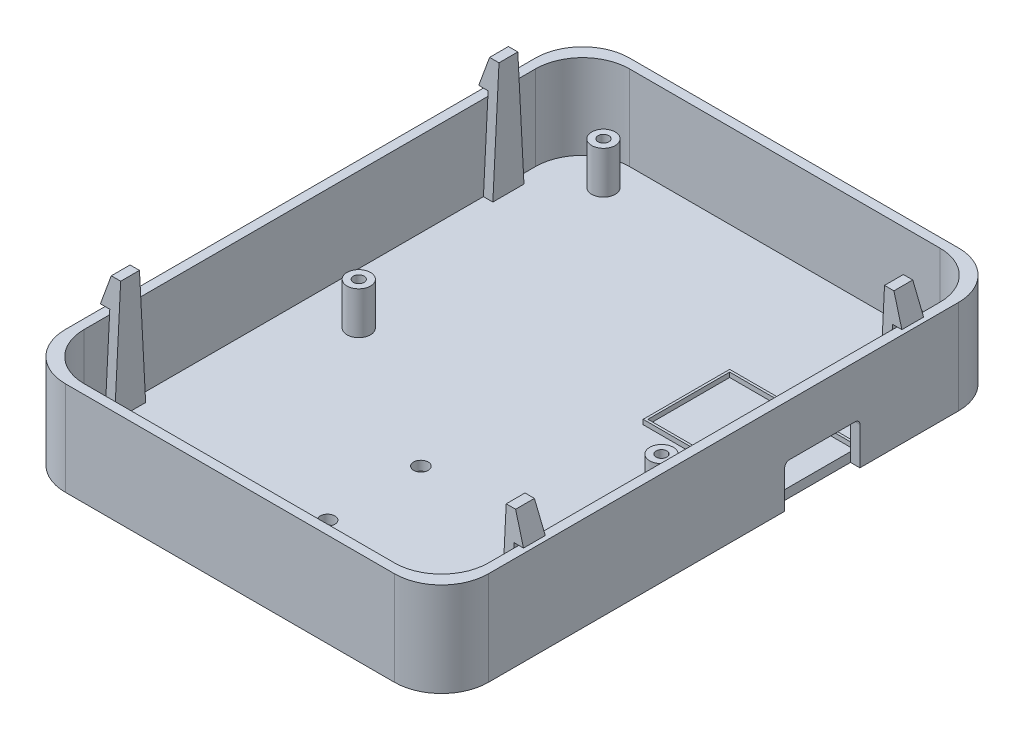
from build123d import *

# Parameters (mm, degrees)
CROQUIS2_W                   = 90
CROQUIS2_H                   = 120
SALIENTE_EXTRUIR1_DEPTH      = 20
VACIADO1_T                   = -2
REDONDEO1_R                  = 10
CROQUIS3_R                   = 1.55
CORTAR_EXTRUIR1_DEPTH        = 20
CROQUIS4_R                   = 2.5
CROQUIS4_R_2                 = 1.15
SALIENTE_EXTRUIR2_DEPTH      = 9
CROQUIS5_W                   = 16
CROQUIS5_H                   = 9
CORTAR_EXTRUIR2_DEPTH        = 2
REDONDEO2_R                  = 1
SALIENTE_EXTRUIR3_DEPTH      = 1
GANCHO_START                 = 41
GANCHO_DE_MOSQUET_N1_DEPTH   = 2
GANCHO_START_2               = -42.549292451
GANCHO_DE_MOSQUET_N1_2_DEPTH = 4.628893351
GANCHO_START_3               = 43
GANCHO_DE_MOSQUET_N1_3_DEPTH = 3
GANCHO_DE_MOSQUET_N1_4_DEPTH = 2
SIMETR_A2_START              = 41
SIMETR_A2_COPY_1_DEPTH       = 2
SIMETR_A2_START_2            = -42.549292451
SIMETR_A2_COPY_2_DEPTH       = 4.628893351
SIMETR_A2_START_3            = 43
SIMETR_A2_COPY_3_DEPTH       = 3
SIMETR_A2_COPY_4_DEPTH       = 2


with BuildPart() as part:
    # Croquis2 → Saliente-Extruir1 (new body)
    with BuildSketch(Plane(origin=(0, 0, 0), x_dir=(1, 0, 0), z_dir=(0, 1, 0))):
        Rectangle(CROQUIS2_W, CROQUIS2_H)
    extrude(amount=SALIENTE_EXTRUIR1_DEPTH)

    # Vaciado1
    vaciado1_openings = [part.faces().sort_by_distance(p)[0] for p in [
        (0, 20, 0),
    ]]
    offset(amount=VACIADO1_T, openings=vaciado1_openings, kind=Kind.INTERSECTION)

    # Redondeo1
    redondeo1_edges = [part.edges().sort_by_distance(p)[0] for p in [
        (-43, 11, -58),
        (-43, 11, 58),
        (43, 11, 58),
        (43, 11, -58),
        (-45, 10, -60),
        (45, 10, -60),
        (45, 10, 60),
        (-45, 10, 60),
    ]]
    fillet(redondeo1_edges, radius=REDONDEO1_R)

    # Croquis3 → Cortar-Extruir1 (cut)
    with BuildSketch(Plane(origin=(0, 2, 0), x_dir=(1, 0, 0), z_dir=(0, 1, 0))):
        with Locations(Location((0, -39.225, 0), (0, 0, 270))):
            Circle(CROQUIS3_R)
        with Locations(Location((0, -19.375, 0), (0, 0, 270))):
            Circle(CROQUIS3_R)
    extrude(amount=-CORTAR_EXTRUIR1_DEPTH, mode=Mode.SUBTRACT)

    # Croquis4 → Saliente-Extruir2 (add)
    # profile 1 of 4: a face of its own
    with BuildSketch(Plane(origin=(0, 2, 0), x_dir=(1, 0, 0), z_dir=(0, 1, 0))):
        with Locations(Location((-31.9, 51.355578, 0), (0, 0, 90))):
            Circle(CROQUIS4_R)
        with Locations(Location((-31.9, 51.355578, 0), (0, 0, 270))):
            Circle(CROQUIS4_R_2, mode=Mode.SUBTRACT)
    # profile 2 of 4: a face of its own
    with BuildSketch(Plane(origin=(0, 2, 0), x_dir=(1, 0, 0), z_dir=(0, 1, 0))):
        with Locations(Location((32.5, 51.355578, 0), (0, 0, 90))):
            Circle(CROQUIS4_R)
        with Locations(Location((32.5, 51.355578, 0), (0, 0, 270))):
            Circle(CROQUIS4_R_2, mode=Mode.SUBTRACT)
    # profile 3 of 4: a face of its own
    with BuildSketch(Plane(origin=(0, 2, 0), x_dir=(1, 0, 0), z_dir=(0, 1, 0))):
        with Locations(Location((32.35, -0.544422, 0), (0, 0, 90))):
            Circle(CROQUIS4_R)
        with Locations(Location((32.35, -0.544422, 0), (0, 0, 270))):
            Circle(CROQUIS4_R_2, mode=Mode.SUBTRACT)
    # profile 4 of 4: a face of its own
    with BuildSketch(Plane(origin=(0, 2, 0), x_dir=(1, 0, 0), z_dir=(0, 1, 0))):
        with Locations(Location((-32.05, -0.544422, 0), (0, 0, 90))):
            Circle(CROQUIS4_R)
        with Locations(Location((-32.05, -0.544422, 0), (0, 0, 270))):
            Circle(CROQUIS4_R_2, mode=Mode.SUBTRACT)
    extrude(amount=SALIENTE_EXTRUIR2_DEPTH)

    # Croquis5 → Cortar-Extruir2 (cut)
    with BuildSketch(Plane(origin=(45, 0, 0), x_dir=(0, 0, -1), z_dir=(1, 0, 0))):
        with Locations((21, 4.5)):
            Rectangle(CROQUIS5_W, CROQUIS5_H)
    extrude(amount=-CORTAR_EXTRUIR2_DEPTH, mode=Mode.SUBTRACT)

    # Redondeo2
    redondeo2_edges = [part.edges().sort_by_distance(p)[0] for p in [
        (44, 9, -13),
        (44, 9, -29),
    ]]
    fillet(redondeo2_edges, radius=REDONDEO2_R)

    # Croquis6 → Saliente-Extruir3 (add)
    with BuildSketch(Plane(origin=(0, 2, 0), x_dir=(1, 0, 0), z_dir=(0, 1, 0))):
        Polygon((43, 29.794557256), (16.5, 29.794557256), (16.5, 12.4), (43, 12.4), (43, 11.9), (16, 11.9), (16, 30.294557256), (43, 30.294557256), align=None)
    extrude(amount=SALIENTE_EXTRUIR3_DEPTH)



with BuildPart() as body_2:
    # Gancho de mosquetón1: read off the stored shape, not the designer's step
    # Gancho de mosquetón1 outline → Gancho de mosquetón1 (new body)
    with BuildSketch(Plane.YZ.offset(GANCHO_START)):
        Polygon((21, -37.9203991), (21, -42.549292451), (27, -42.234845775), (27, -38.234845775), align=None)
    gancho_de_mosquet_n1 = extrude(amount=GANCHO_DE_MOSQUET_N1_DEPTH)

    # Gancho de mosquet_n1 2 outline → Gancho de mosquet_n1 2 (add)
    with BuildSketch(Plane.XY.offset(GANCHO_START_2)):
        Polygon((43, 21), (45, 21), (43, 27), align=None)
    gancho_de_mosquet_n1_2 = extrude(amount=GANCHO_DE_MOSQUET_N1_2_DEPTH)

    # Gancho de mosquet_n1 3 outline → Gancho de mosquet_n1 3 (cut)
    with BuildSketch(Plane.YZ.offset(GANCHO_START_3)):
        Polygon((27, -42.234845775), (21, -42.549292451), (28, -42.549292451), (28, -42.182437996), align=None)
        Polygon((28, -37.9203991), (21, -37.9203991), (27, -38.234845775), (28, -38.287253554), align=None)
    gancho_de_mosquet_n1_3 = extrude(amount=GANCHO_DE_MOSQUET_N1_3_DEPTH, mode=Mode.SUBTRACT)


with BuildPart() as part_1:
    add(part.part)

    add(body_2.part)  # Gancho de mosquet_n1 4 merges body 2
    # Gancho de mosquet_n1 4 outline → Gancho de mosquet_n1 4 (add)
    with BuildSketch(Plane.YZ.offset(GANCHO_START)):
        Polygon((1, -43.597448037), (2, -43.545040258), (21, -42.549292451), (21, -37.9203991), (2, -36.924651293), (1, -36.872243514), align=None)
    gancho_de_mosquet_n1_4 = extrude(amount=GANCHO_DE_MOSQUET_N1_4_DEPTH)

    # Simetría1: Gancho de mosquetón1, Gancho de mosquet_n1 2, Gancho de mosquet_n1 3, Gancho de mosquet_n1 4 across plane
    add(gancho_de_mosquet_n1.mirror(Plane.XY))
    add(gancho_de_mosquet_n1_2.mirror(Plane.XY))
    add(gancho_de_mosquet_n1_3.mirror(Plane.XY), mode=Mode.SUBTRACT)
    add(gancho_de_mosquet_n1_4.mirror(Plane.XY))

    # Simetría2: Gancho de mosquetón1, Gancho de mosquet_n1 2, Gancho de mosquet_n1 3, Gancho de mosquet_n1 4 across plane
    add(gancho_de_mosquet_n1.mirror(Plane(origin=(0, 0, 0), x_dir=(0, 0, 1), z_dir=(1, 0, 0))))
    add(gancho_de_mosquet_n1_2.mirror(Plane(origin=(0, 0, 0), x_dir=(0, 0, 1), z_dir=(1, 0, 0))))
    add(gancho_de_mosquet_n1_3.mirror(Plane(origin=(0, 0, 0), x_dir=(0, 0, 1), z_dir=(1, 0, 0))), mode=Mode.SUBTRACT)
    add(gancho_de_mosquet_n1_4.mirror(Plane(origin=(0, 0, 0), x_dir=(0, 0, 1), z_dir=(1, 0, 0))))



with BuildPart() as body_2_2:
    # Simetría2 copy 1 sketch → Simetría2 copy 1 (new body)
    with BuildSketch(Plane(origin=(0, 0, 0), x_dir=(0, 1, 0), z_dir=(-1, 0, 0)).offset(SIMETR_A2_START)):
        Polygon((21, -37.9203991), (21, -42.549292451), (27, -42.234845775), (27, -38.234845775), align=None)
    extrude(amount=SIMETR_A2_COPY_1_DEPTH)

    # Simetría2 copy 2 sketch → Simetría2 copy 2 (add)
    with BuildSketch(Plane(origin=(0, 0, 0), x_dir=(-1, 0, 0), z_dir=(0, 0, -1)).offset(SIMETR_A2_START_2)):
        Polygon((43, 21), (45, 21), (43, 27), align=None)
    extrude(amount=SIMETR_A2_COPY_2_DEPTH)

    # Simetría2 copy 3 sketch → Simetría2 copy 3 (cut)
    with BuildSketch(Plane(origin=(0, 0, 0), x_dir=(0, 1, 0), z_dir=(-1, 0, 0)).offset(SIMETR_A2_START_3)):
        Polygon((27, -42.234845775), (21, -42.549292451), (28, -42.549292451), (28, -42.182437996), align=None)
        Polygon((28, -37.9203991), (21, -37.9203991), (27, -38.234845775), (28, -38.287253554), align=None)
    extrude(amount=SIMETR_A2_COPY_3_DEPTH, mode=Mode.SUBTRACT)


with BuildPart() as part_2:
    add(part_1.part)

    add(body_2_2.part)  # Simetría2 copy 4 merges body 2 2
    # Simetría2 copy 4 sketch → Simetría2 copy 4 (add)
    with BuildSketch(Plane(origin=(0, 0, 0), x_dir=(0, 1, 0), z_dir=(-1, 0, 0)).offset(SIMETR_A2_START)):
        Polygon((1, -43.597448037), (2, -43.545040258), (21, -42.549292451), (21, -37.9203991), (2, -36.924651293), (1, -36.872243514), align=None)
    extrude(amount=SIMETR_A2_COPY_4_DEPTH)


solid = part_2.part
